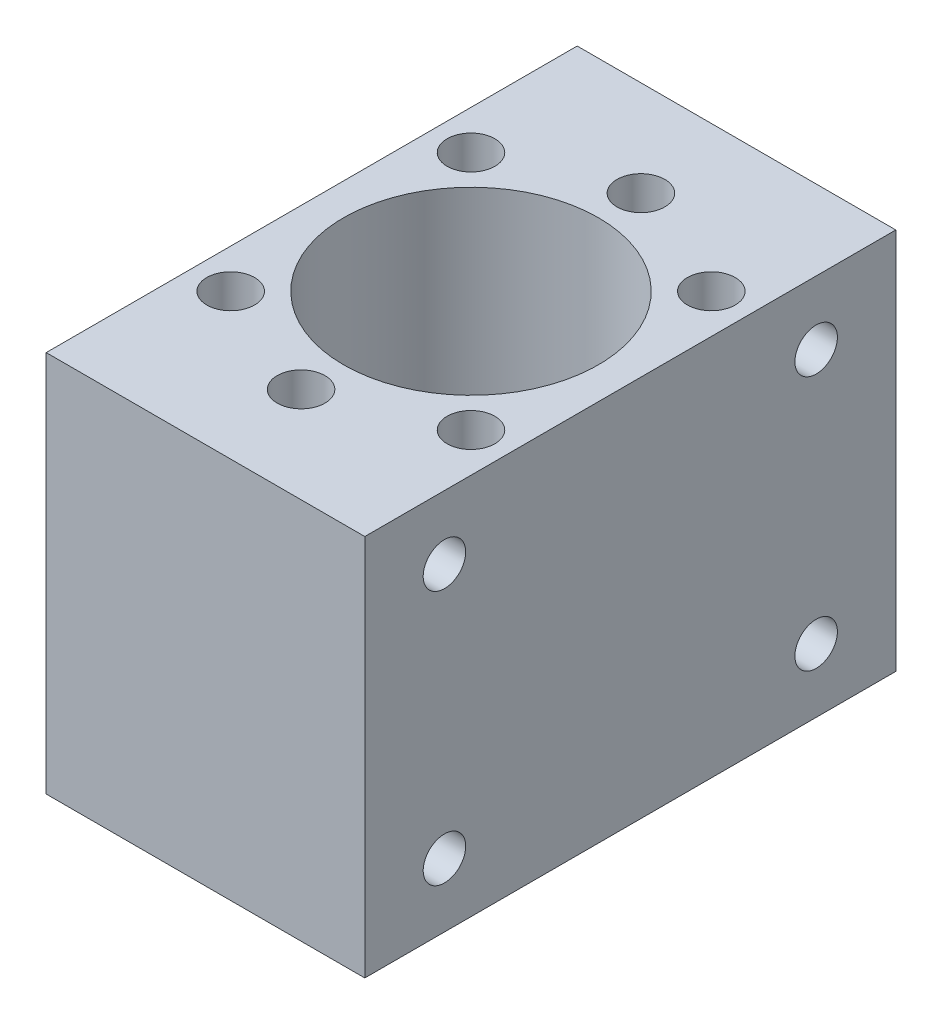
from build123d import *

# Parameters (mm, degrees)
SKETCH_1_R           = 12
SKETCH_1_R_2         = 6
EXTRUDE_1_DEPTH      = 30
SKETCH_2_R           = 6
SKETCH_2_R_2         = 2.25
EXTRUDE_2_DEPTH      = 10
EXTRUDE_START        = -36
SKETCH_23_W          = 30
SKETCH_23_H          = 50
SKETCH_23_R          = 2.25
EXTRUDE_10_DEPTH     = 36
SKETCH_24_W          = 30
SKETCH_24_H          = 8
CUT_EXTRUDE_16_DEPTH = 66.76473219
SKETCH_25_R          = 12
CUT_EXTRUDE_17_DEPTH = 47.324939288
SKETCH_26_R          = 2
CUT_EXTRUDE_18_DEPTH = 10


with BuildPart() as part:
    # 草图1 → 凸台-拉伸1 (new body)
    with BuildSketch(Plane(origin=(0, 0, 0), x_dir=(1, 0, 0), z_dir=(0, 1, 0))):
        Circle(SKETCH_1_R)
        Circle(SKETCH_1_R_2, mode=Mode.SUBTRACT)
    extrude(amount=EXTRUDE_1_DEPTH)

    # 草图2 → 凸台-拉伸2 (add)
    with BuildSketch(Plane(origin=(0, 30, 0), x_dir=(1, 0, 0), z_dir=(0, 1, 0))):
        with BuildLine():
            Line((-15, 13.228756555), (-15, -13.228756555))
            ThreePointArc((-15, -13.228756555), (0, -20), (15, -13.228756555))
            Line((15, -13.228756555), (15, 13.228756555))
            ThreePointArc((15, 13.228756555), (0, 20), (-15, 13.228756555))
        make_face()
        Circle(SKETCH_2_R, mode=Mode.SUBTRACT)
        with Locations((0, 16)):
            Circle(SKETCH_2_R_2, mode=Mode.SUBTRACT)
        with Locations((11.313708499, 11.313708499)):
            Circle(SKETCH_2_R_2, mode=Mode.SUBTRACT)
        with Locations((11.313708499, -11.313708499)):
            Circle(SKETCH_2_R_2, mode=Mode.SUBTRACT)
        with Locations((0, -16)):
            Circle(SKETCH_2_R_2, mode=Mode.SUBTRACT)
        with Locations((-11.313708499, -11.313708499)):
            Circle(SKETCH_2_R_2, mode=Mode.SUBTRACT)
        with Locations((-11.313708499, 11.313708499)):
            Circle(SKETCH_2_R_2, mode=Mode.SUBTRACT)
    extrude(amount=EXTRUDE_2_DEPTH)

    # 草图23 → 凸台-拉伸10 (add)
    with BuildSketch(Plane(origin=(0, 40, 0), x_dir=(1, 0, 0), z_dir=(0, 1, 0)).offset(EXTRUDE_START)):
        Rectangle(SKETCH_23_W, SKETCH_23_H)
        with Locations((-11.313708499, -11.313708499)):
            Circle(SKETCH_23_R, mode=Mode.SUBTRACT)
        with Locations((0, -16)):
            Circle(SKETCH_23_R, mode=Mode.SUBTRACT)
        with Locations((11.313708499, -11.313708499)):
            Circle(SKETCH_23_R, mode=Mode.SUBTRACT)
        with Locations((11.313708499, 11.313708499)):
            Circle(SKETCH_23_R, mode=Mode.SUBTRACT)
        with Locations((0, 16)):
            Circle(SKETCH_23_R, mode=Mode.SUBTRACT)
        with Locations((-11.313708499, 11.313708499)):
            Circle(SKETCH_23_R, mode=Mode.SUBTRACT)
    extrude(amount=EXTRUDE_10_DEPTH)

    # 草图24 → 切除-拉伸16 (cut, through all)
    with BuildSketch(Plane.XY.offset(25)):
        Rectangle(SKETCH_24_W, SKETCH_24_H)
    extrude(amount=-CUT_EXTRUDE_16_DEPTH, mode=Mode.SUBTRACT)

    # 草图25 → 切除-拉伸17 (cut, through all)
    with BuildSketch(Plane(origin=(0, 40, 0), x_dir=(1, 0, 0), z_dir=(0, 1, 0))):
        Circle(SKETCH_25_R)
    extrude(amount=-CUT_EXTRUDE_17_DEPTH, mode=Mode.SUBTRACT)

    # 草图26 → 切除-拉伸18 (cut)
    with BuildSketch(Plane(origin=(15, 0, 0), x_dir=(0, 0, -1), z_dir=(1, 0, 0))):
        with Locations((17.5, 34)):
            Circle(SKETCH_26_R)
        with Locations((-17.5, 34)):
            Circle(SKETCH_26_R)
        with Locations((-17.5, 10)):
            Circle(SKETCH_26_R)
        with Locations((17.5, 10)):
            Circle(SKETCH_26_R)
    extrude(amount=-CUT_EXTRUDE_18_DEPTH, mode=Mode.SUBTRACT)


solid = part.part
